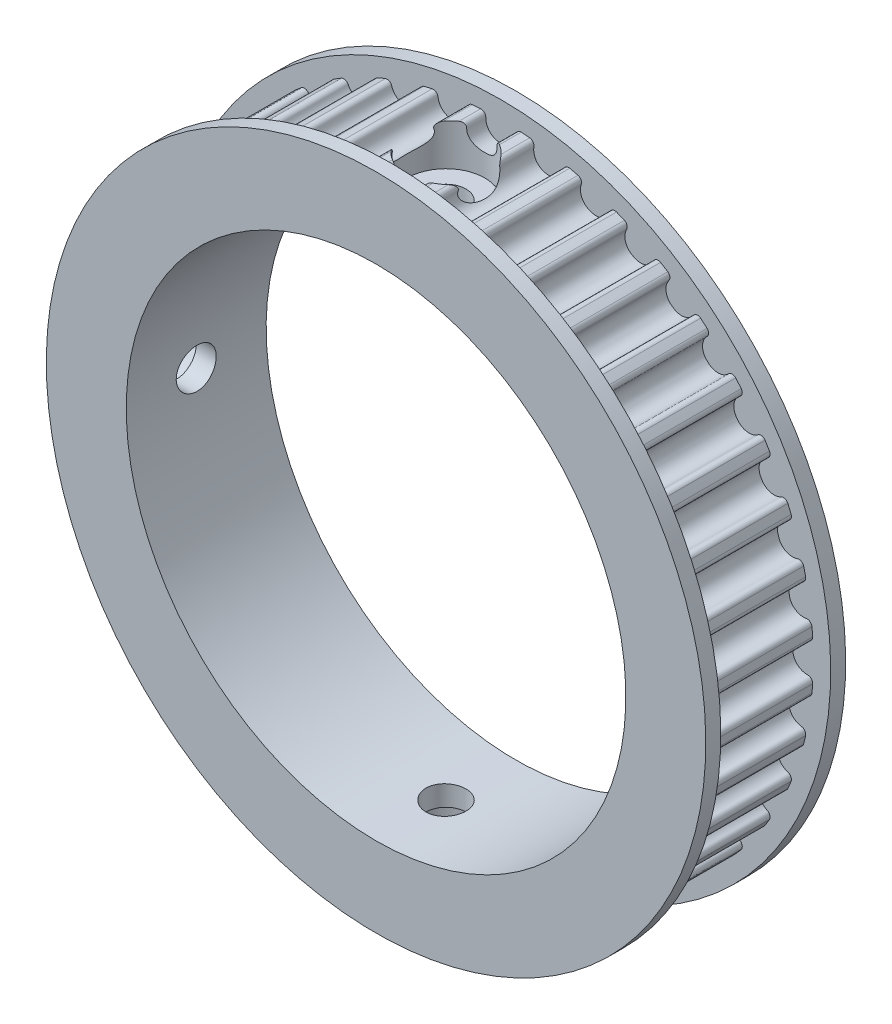
from build123d import *

# Parameters (mm, degrees)
CUT_EXTRUDE_01_DEPTH      = 5.5
PATTERN_CIRCULAR_01_COUNT = 40
SKETCH_683_W              = 14.477999782
SKETCH_683_H              = 25
SKETCH_5_R                = 2
CUT_EXTRUDE_2_DEPTH       = 27
SKETCH_6_R                = 3.9
CUT_EXTRUDE_3_DEPTH       = 69.833131703
PATTERN_CIRCULAR_2_COUNT  = 3
PATTERN_CIRCULAR_2_ANGLE  = 180


with BuildPart() as part:
    # Sketch 01 → 同步带轮01 (revolve)
    with BuildSketch(Plane(origin=(0, 0, 0), x_dir=(0, 0, -1), z_dir=(1, 0, 0))):
        Polygon((7, 0), (7, 33), (5.5, 33), (5.5, 31.259474731), (-5.5, 31.259474731), (-5.5, 33), (-7, 33), (-7, 0), align=None)
    revolve(axis=Axis((0, 0, 7), (0, 0, 1)))

    # Sketch 01 2 → 齿拉伸切除同步带轮01 (cut, symmetric)
    with BuildSketch(Plane.XY):
        with BuildLine():
            ThreePointArc((31.193039128, 2.038865882), (31.259601152, 0), (31.193039128, -2.038865882))
            add(Edge.make_bspline(
                [(31.193039128, -2.038865882), (31.194776913, -2.012319058), (31.194111995, -1.972286092), (31.186725044, -1.91954954), (31.177972892, -1.880581805), (31.166066964, -1.842459179), (31.151086916, -1.805436436), (31.133132836, -1.769761004), (31.11232472, -1.735671302), (31.088801629, -1.703395156), (31.062720769, -1.673148271), (31.03425644, -1.645132783), (31.003598871, -1.619535939), (30.970952951, -1.596528744), (30.936536852, -1.576265181), (30.900580587, -1.558879838), (30.863324423, -1.544492019), (30.825017467, -1.533186249), (30.785915276, -1.525081482), (30.746280852, -1.520069931), (30.699160655, -1.5185581), (30.627744929, -1.519642809), (30.531954075, -1.516025397), (30.419766309, -1.502618406), (30.308964203, -1.4805345), (30.200238466, -1.449806972), (30.094256736, -1.410652655), (29.991672503, -1.363305381), (29.893117585, -1.308058815), (29.799199177, -1.245252775), (29.710495857, -1.175274324), (29.627554091, -1.09855453), (29.55088484, -1.015566038), (29.480960449, -0.926820101), (29.418211615, -0.832863447), (29.363025195, -0.73427489), (29.31574008, -0.631661826), (29.276651638, -0.525656278), (29.245985501, -0.416911781), (29.223987221, -0.306096466), (29.210580967, -0.193899714), (29.207480791, -0.105119728), (29.207768884, -0.040500395), (29.2077087, 0), (29.207768884, 0.040500395), (29.207480791, 0.105119728), (29.210580967, 0.193899714), (29.223987221, 0.306096466), (29.245985501, 0.416911781), (29.276651638, 0.525656278), (29.31574008, 0.631661826), (29.363025195, 0.73427489), (29.418211615, 0.832863447), (29.480960449, 0.926820101), (29.55088484, 1.015566038), (29.627554091, 1.09855453), (29.710495857, 1.175274324), (29.799199177, 1.245252775), (29.893117585, 1.308058815), (29.991672503, 1.363305381), (30.094256736, 1.410652655), (30.200238466, 1.449806972), (30.308964203, 1.4805345), (30.419766309, 1.502618406), (30.531954075, 1.516025397), (30.627744929, 1.519642809), (30.699160655, 1.5185581), (30.746280852, 1.520069931), (30.785915276, 1.525081482), (30.825017467, 1.533186249), (30.863324423, 1.544492019), (30.900580587, 1.558879838), (30.936536852, 1.576265181), (30.970952951, 1.596528744), (31.003598871, 1.619535939), (31.03425644, 1.645132783), (31.062720769, 1.673148271), (31.088801629, 1.703395156), (31.11232472, 1.735671302), (31.133132836, 1.769761004), (31.151086916, 1.805436436), (31.166066964, 1.842459179), (31.177972892, 1.880581805), (31.186725044, 1.91954954), (31.194111995, 1.972286092), (31.194776913, 2.012319058), (31.193039128, 2.038865882)],
                knots=[0, 0, 0, 0, 0.012475647, 0.018713471, 0.024951294, 0.031189118, 0.037426941, 0.043664765, 0.049902589, 0.056140412, 0.062378236, 0.068616059, 0.074853883, 0.081091706, 0.08732953, 0.093567353, 0.099805177, 0.106043001, 0.112280824, 0.118518648, 0.124756471, 0.134376181, 0.152024115, 0.169672048, 0.187319982, 0.204967916, 0.22261585, 0.240263783, 0.257911717, 0.275559651, 0.293207585, 0.310855518, 0.328503452, 0.346151386, 0.36379932, 0.381447253, 0.399095187, 0.416743121, 0.434391055, 0.452038988, 0.469686922, 0.487334856, 0.493667428, 0.5, 0.506332572, 0.512665144, 0.530313078, 0.547961012, 0.565608945, 0.583256879, 0.600904813, 0.618552747, 0.63620068, 0.653848614, 0.671496548, 0.689144482, 0.706792415, 0.724440349, 0.742088283, 0.759736217, 0.77738415, 0.795032084, 0.812680018, 0.830327952, 0.847975885, 0.865623819, 0.875243529, 0.881481352, 0.887719176, 0.893956999, 0.900194823, 0.906432647, 0.91267047, 0.918908294, 0.925146117, 0.931383941, 0.937621764, 0.943859588, 0.950097411, 0.956335235, 0.962573059, 0.968810882, 0.975048706, 0.981286529, 0.987524353, 1, 1, 1, 1], degree=3))
        make_face()
    cut_extrude_01 = extrude(amount=CUT_EXTRUDE_01_DEPTH, both=True, mode=Mode.SUBTRACT)

    # 齿形同步带轮01: 齿拉伸切除同步带轮01 ×40 about axis
    pattern_circular_01_axis = Axis((0, 0, 55), (0, 0, -1))
    for i in range(1, PATTERN_CIRCULAR_01_COUNT):
        add(cut_extrude_01.rotate(pattern_circular_01_axis, i * 360 / PATTERN_CIRCULAR_01_COUNT), mode=Mode.SUBTRACT)

    # Sketch 683 → Cut-Revolve 722 (revolve, cut)
    with BuildSketch(Plane(origin=(0, 0, 0), x_dir=(0, 0, -1), z_dir=(1, 0, 0))):
        with Locations((0, 12.5)):
            Rectangle(SKETCH_683_W, SKETCH_683_H)
    revolve(axis=Axis((0, 0, 0), (0, 0, -1)), mode=Mode.SUBTRACT)

    # 草图5 → 切除-拉伸2 (cut)
    with BuildSketch(Plane(origin=(0, 0, 0), x_dir=(1, 0, 0), z_dir=(0, 1, 0))):
        Circle(SKETCH_5_R)
    cut_extrude_2 = extrude(amount=-CUT_EXTRUDE_2_DEPTH, mode=Mode.SUBTRACT)

    # 草图6 → 切除-拉伸3 (cut, through all)
    with BuildSketch(Plane(origin=(0, -27, 0), x_dir=(1, 0, 0), z_dir=(0, 1, 0))):
        Circle(SKETCH_6_R)
    cut_extrude_3 = extrude(amount=-CUT_EXTRUDE_3_DEPTH, mode=Mode.SUBTRACT)

    # 阵列(圆周)2: 切除-拉伸2, 切除-拉伸3 ×3 about axis
    pattern_circular_2_axis = Axis((0, 0, 0), (0, 0, -1))
    add([cut_extrude_2.rotate(pattern_circular_2_axis, i * PATTERN_CIRCULAR_2_ANGLE / (PATTERN_CIRCULAR_2_COUNT - 1)) for i in range(1, PATTERN_CIRCULAR_2_COUNT)], mode=Mode.SUBTRACT)
    add([cut_extrude_3.rotate(pattern_circular_2_axis, i * PATTERN_CIRCULAR_2_ANGLE / (PATTERN_CIRCULAR_2_COUNT - 1)) for i in range(1, PATTERN_CIRCULAR_2_COUNT)], mode=Mode.SUBTRACT)


solid = part.part
